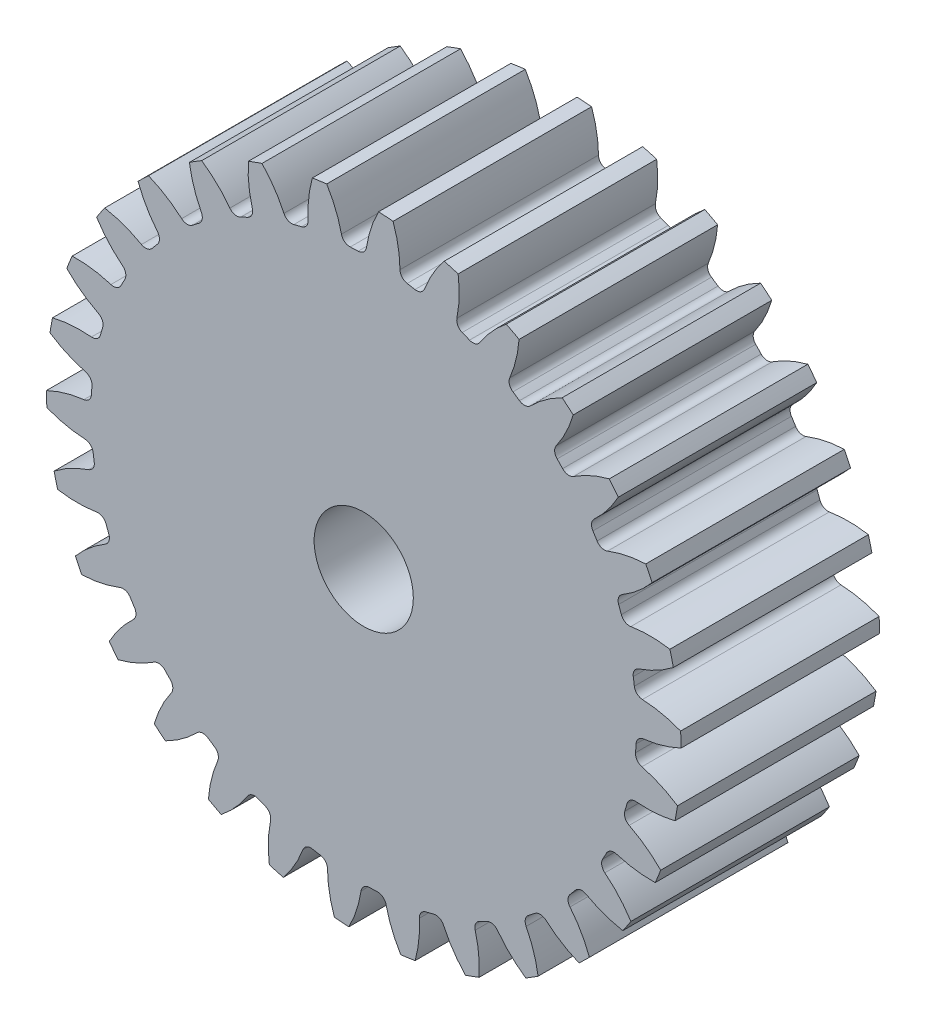
from build123d import *

# Parameters (mm, degrees)
SKETCH3_R         = 16
GEARBODY_DEPTH    = 10.007599831
TOOTHCUT_DEPTH    = 25.74170678
CIRPATTERN1_COUNT = 30
HUB1DIA_R         = 5
HUB1_DEPTH        = 5
BOREDIA_R         = 2.5
BORE_DEPTH        = 12700


with BuildPart() as part:
    # Sketch3 → gearBody (new body)
    with BuildSketch(Plane.XY):
        Circle(SKETCH3_R)
    extrude(amount=GEARBODY_DEPTH)

    # Sketch2 → toothCut (cut, through all)
    with BuildSketch(Plane.XY):
        with BuildLine():
            ThreePointArc((13.700546667, -1.15564772), (13.715841612, -0.957177887), (13.728261621, -0.758507422))
            ThreePointArc((13.728261621, -0.758507422), (13.844672327, -0.486941774), (14.108595922, -0.354112222))
            ThreePointArc((14.108595922, -0.354112222), (16.499052604, 0.46582024), (18.333818862, 2.203693989))
            ThreePointArc((18.333818862, 2.203693989), (18.420982278, -1.285532261), (17.850023597, -4.728830603))
            ThreePointArc((17.850023597, -4.728830603), (16.274425818, -2.752960154), (14.021025427, -1.608950073))
            ThreePointArc((14.021025427, -1.608950073), (13.778109572, -1.440750069), (13.700546667, -1.15564772))
        make_face()
    toothcut = extrude(amount=TOOTHCUT_DEPTH, mode=Mode.SUBTRACT)

    # CirPattern1: toothCut ×30 about axis
    cirpattern1_axis = Axis((0, 0, 10.007599831), (0, 0, -1))
    for i in range(1, CIRPATTERN1_COUNT):
        add(toothcut.rotate(cirpattern1_axis, i * 360 / CIRPATTERN1_COUNT), mode=Mode.SUBTRACT)

    # hub1Dia → hub1 (add)
    with BuildSketch(Plane(origin=(0, 0, 0), x_dir=(-1, 0, 0), z_dir=(0, 0, -1))):
        Circle(HUB1DIA_R)
    extrude(amount=HUB1_DEPTH)

    # boreDia → bore (cut, symmetric)
    with BuildSketch(Plane.XY):
        Circle(BOREDIA_R)
    extrude(amount=BORE_DEPTH, both=True, mode=Mode.SUBTRACT)


solid = part.part
